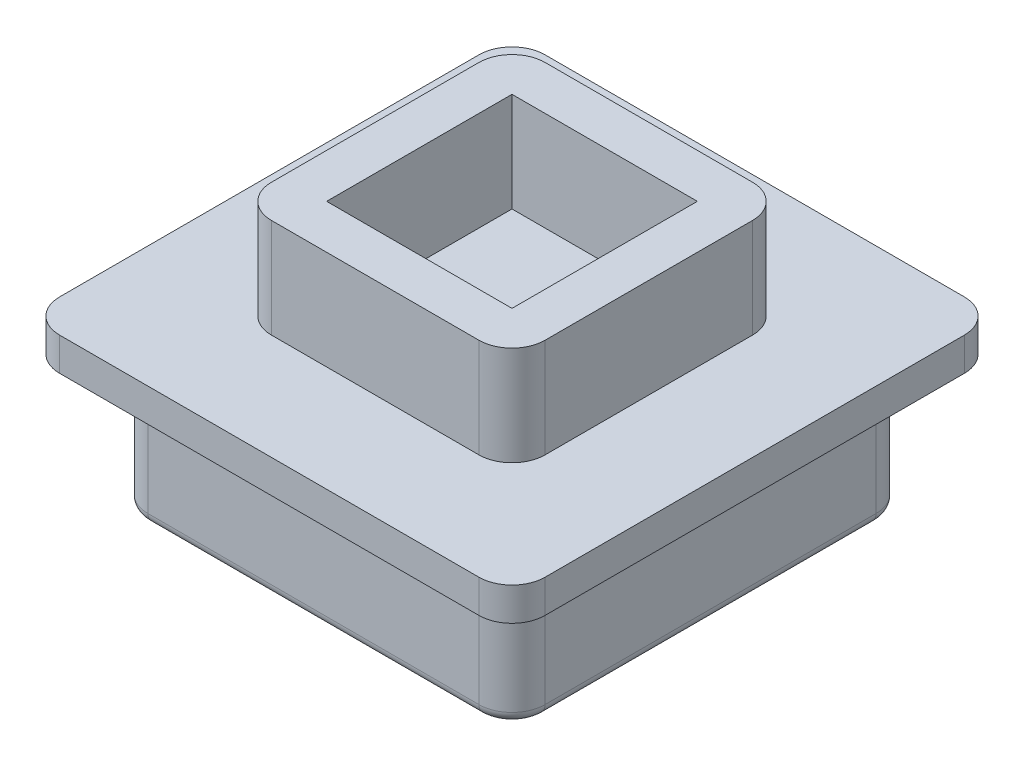
from build123d import *

# Parameters (mm, degrees)
SKETCH1_W           = 9
SKETCH1_H           = 9
BOSS_EXTRUDE1_DEPTH = 3
SKETCH2_W           = 11
SKETCH2_H           = 11
BOSS_EXTRUDE2_DEPTH = 0.75
SKETCH3_W           = 6.2
SKETCH3_H           = 6.2
SKETCH3_W_2         = 4.2
SKETCH3_H_2         = 4.2
BOSS_EXTRUDE3_DEPTH = 2.25
FILLET1_R           = 0.75
FILLET2_R           = 0.25


with BuildPart() as part:
    # Sketch1 → Boss-Extrude1 (new body)
    with BuildSketch(Plane(origin=(0, 0, 0), x_dir=(1, 0, 0), z_dir=(0, 1, 0))):
        Rectangle(SKETCH1_W, SKETCH1_H)
    extrude(amount=BOSS_EXTRUDE1_DEPTH)

    # Sketch2 → Boss-Extrude2 (add)
    with BuildSketch(Plane(origin=(0, 3, 0), x_dir=(1, 0, 0), z_dir=(0, 1, 0))):
        Rectangle(SKETCH2_W, SKETCH2_H)
    extrude(amount=BOSS_EXTRUDE2_DEPTH)

    # Sketch3 → Boss-Extrude3 (add)
    with BuildSketch(Plane(origin=(0, 3.75, 0), x_dir=(1, 0, 0), z_dir=(0, 1, 0))):
        Rectangle(SKETCH3_W, SKETCH3_H)
        Rectangle(SKETCH3_W_2, SKETCH3_H_2, mode=Mode.SUBTRACT)
    extrude(amount=BOSS_EXTRUDE3_DEPTH)

    # Fillet1
    fillet1_edges = [part.edges().sort_by_distance(p)[0] for p in [
        (-3.1, 4.875, 3.1),
        (-3.1, 4.875, -3.1),
        (3.1, 4.875, -3.1),
        (3.1, 4.875, 3.1),
        (5.5, 3.375, 5.5),
        (-5.5, 3.375, 5.5),
        (-5.5, 3.375, -5.5),
        (5.5, 3.375, -5.5),
        (4.5, 1.5, -4.5),
        (-4.5, 1.5, -4.5),
        (-4.5, 1.5, 4.5),
        (4.5, 1.5, 4.5),
    ]]
    fillet(fillet1_edges, radius=FILLET1_R)

    # Fillet2
    fillet2_edges = [part.edges().sort_by_distance(p)[0] for p in [
        (4.280330086, 0, -4.280330086),
        (4.5, 0, 0),
        (4.280330086, 0, 4.280330086),
        (0, 0, 4.5),
        (-4.280330086, 0, 4.280330086),
        (-4.5, 0, 0),
        (-4.280330086, 0, -4.280330086),
        (0, 0, -4.5),
    ]]
    fillet(fillet2_edges, radius=FILLET2_R)


solid = part.part
